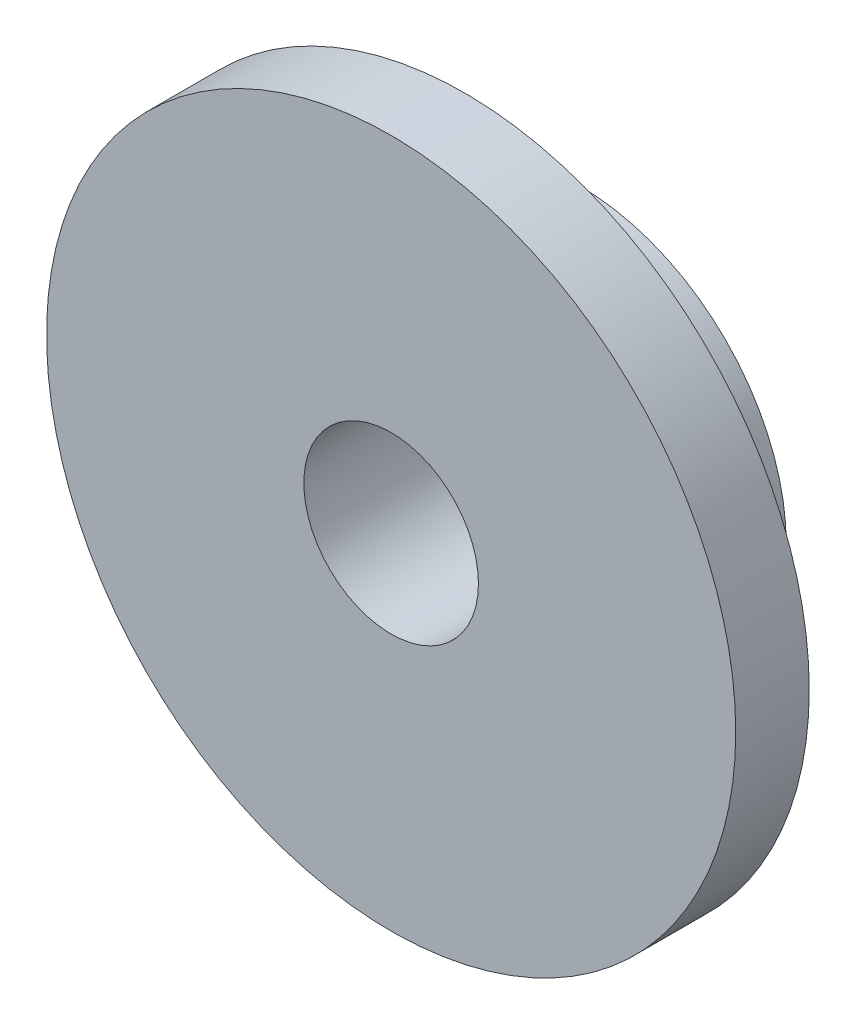
from build123d import *

# Parameters (mm, degrees)
SKETCH_1_R      = 4.5
SKETCH_1_R_2    = 1.9
EXTRUDE_1_DEPTH = 2.5
SKETCH_2_R      = 7.5
SKETCH_2_R_2    = 1.9
EXTRUDE_2_DEPTH = 1.6


with BuildPart() as part:
    # ｽｹｯﾁ1 → ﾎﾞｽ - 押し出し1 (new body)
    with BuildSketch(Plane.XY):
        Circle(SKETCH_1_R)
        Circle(SKETCH_1_R_2, mode=Mode.SUBTRACT)
    extrude(amount=EXTRUDE_1_DEPTH)

    # ｽｹｯﾁ2 → ﾎﾞｽ - 押し出し2 (add)
    with BuildSketch(Plane.XY.offset(2.5)):
        Circle(SKETCH_2_R)
        Circle(SKETCH_2_R_2, mode=Mode.SUBTRACT)
    extrude(amount=EXTRUDE_2_DEPTH)


solid = part.part
